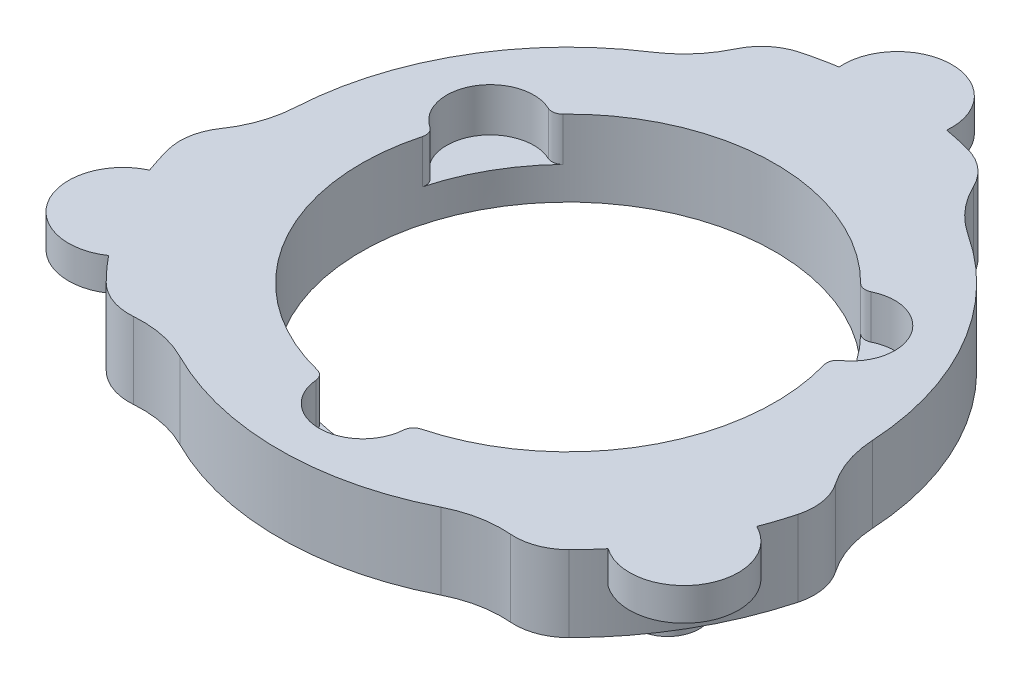
from build123d import *

# Parameters (mm, degrees)
SKETCH1_R                = 19
BOSS_EXTRUDE1_DEPTH      = 3.5
SKETCH2_R                = 30
SKETCH2_R_2              = 19
SKETCH2_R_3              = 2.8
BOSS_EXTRUDE2_DEPTH      = 7
BOSS_EXTRUDE3_DEPTH      = 2
BOSS_EXTRUDE3_DEPTH_BACK = 7
SKETCH4_R                = 2.9
SKETCH5_R                = 5
BOSS_EXTRUDE4_DEPTH      = 3
CUT_EXTRUDE1_START       = -10
SKETCH3_R                = 19
CUT_EXTRUDE1_DEPTH       = 10
CUT_EXTRUDE3_START       = -13
CUT_EXTRUDE3_DEPTH       = 13
FILLET1_R                = 10
FILLET2_R                = 5
CUT_EXTRUDE4_START       = -4
SKETCH8_R                = 4
SKETCH8_R_2              = 19
CUT_EXTRUDE4_DEPTH       = 4
FILLET3_R                = 1


with BuildPart() as part:
    # Sketch1 → Boss-Extrude1 (new body)
    with BuildSketch(Plane(origin=(0, 0, 0), x_dir=(1, 0, 0), z_dir=(0, 1, 0))):
        with Locations(Location((0, 0, 0), (0, 0, 270))):
            Circle(SKETCH1_R)
    extrude(amount=BOSS_EXTRUDE1_DEPTH)

    # Sketch2 → Boss-Extrude2 (add)
    with BuildSketch(Plane(origin=(0, 0, 0), x_dir=(1, 0, 0), z_dir=(0, 1, 0))):
        with Locations(Location((0, 0, 0), (0, 0, 270))):
            Circle(SKETCH2_R)
        with Locations(Location((0, 0, 0), (0, 0, 270))):
            Circle(SKETCH2_R_2, mode=Mode.SUBTRACT)
        with Locations(Location((0, 25, 0), (0, 0, 270))):
            Circle(SKETCH2_R_3, mode=Mode.SUBTRACT)
        with Locations(Location((21.650635095, -12.5, 0), (0, 0, 270))):
            Circle(SKETCH2_R_3, mode=Mode.SUBTRACT)
        with Locations(Location((-21.650635095, -12.5, 0), (0, 0, 270))):
            Circle(SKETCH2_R_3, mode=Mode.SUBTRACT)
    extrude(amount=BOSS_EXTRUDE2_DEPTH)

    # Sketch4 → Boss-Extrude3 (add, two sides: drawn at the far end of the back side and taken through both)
    with BuildSketch(Plane.XZ.offset(-BOSS_EXTRUDE3_DEPTH_BACK)):
        with Locations(Location((-21.650635095, 12.5, 0), (0, 0, 270))):
            Circle(SKETCH4_R)
        with Locations(Location((21.650635095, 12.5, 0), (0, 0, 270))):
            Circle(SKETCH4_R)
        with Locations(Location((0, -25, 0), (0, 0, 270))):
            Circle(SKETCH4_R)
    extrude(amount=BOSS_EXTRUDE3_DEPTH + BOSS_EXTRUDE3_DEPTH_BACK)

    # Sketch5 → Boss-Extrude4 (add)
    with BuildSketch(Plane(origin=(0, 7, 0), x_dir=(1, 0, 0), z_dir=(0, 1, 0))):
        with Locations((-26.103110985, -14.7860609)):
            Circle(SKETCH5_R)
        with Locations((0.246451131, 29.99898768)):
            Circle(SKETCH5_R)
        with Locations((25.856659853, -15.212926781)):
            Circle(SKETCH5_R)
    extrude(amount=-BOSS_EXTRUDE4_DEPTH)

    # Sketch3 → Cut-Extrude1 (cut)
    with BuildSketch(Plane(origin=(0, 3.5, 0), x_dir=(1, 0, 0), z_dir=(0, 1, 0)).offset(CUT_EXTRUDE1_START)):
        with Locations(Location((0, 0, 0), (0, 0, 270))):
            Circle(SKETCH3_R)
    extrude(amount=CUT_EXTRUDE1_DEPTH, mode=Mode.SUBTRACT)

    # Sketch7 → Cut-Extrude3 (cut)
    with BuildSketch(Plane(origin=(0, 7, 0), x_dir=(1, 0, 0), z_dir=(0, 1, 0)).offset(CUT_EXTRUDE3_START)):
        with BuildLine():
            ThreePointArc((-29.54423259, -5.20944533), (-25.980762114, 15), (-10.2606043, 28.190778624))
            Line((-10.2606043, 28.190778624), (-13.773984089, 37.84371026))
            Line((-13.773984089, 37.84371026), (-43.939319858, -7.747687605))
            Line((-43.939319858, -7.747687605), (-29.54423259, -5.20944533))
        make_face()
        with BuildLine():
            ThreePointArc((-26.13264562, -4.6078905), (-22.980662881, 13.267891901), (-9.075772579, 24.935480225))
            Line((-9.075772579, 24.935480225), (-10.2606043, 28.190778624))
            ThreePointArc((-10.2606043, 28.190778624), (-25.980762114, 15), (-29.54423259, -5.20944533))
            Line((-29.54423259, -5.20944533), (-26.13264562, -4.6078905))
        make_face()
        with BuildLine():
            Line((15.259965643, 41.926411025), (10.2606043, 28.190778624))
            ThreePointArc((10.2606043, 28.190778624), (25.980762114, 15), (29.54423259, -5.20944533))
            Line((29.54423259, -5.20944533), (39.660606503, -6.993234998))
            Line((39.660606503, -6.993234998), (15.259965643, 41.926411025))
        make_face()
        with BuildLine():
            Line((10.2606043, 28.190778624), (9.075772579, 24.935480225))
            ThreePointArc((9.075772579, 24.935480225), (21.736841548, 15.220300308), (26.535783801, 0))
            ThreePointArc((26.535783801, 0), (26.434807132, -2.312745947), (26.13264562, -4.6078905))
            Line((26.13264562, -4.6078905), (29.54423259, -5.20944533))
            ThreePointArc((29.54423259, -5.20944533), (25.980762114, 15), (10.2606043, 28.190778624))
        make_face()
        with BuildLine():
            Line((28.679354216, -34.17872342), (19.283628291, -22.981333294))
            ThreePointArc((19.283628291, -22.981333294), (0, -30), (-19.283628291, -22.981333294))
            Line((-19.283628291, -22.981333294), (-25.886622414, -30.850475262))
            Line((-25.886622414, -30.850475262), (28.679354216, -34.17872342))
        make_face()
        with BuildLine():
            Line((19.283628291, -22.981333294), (17.056873041, -20.327589725))
            ThreePointArc((17.056873041, -20.327589725), (0, -26.535783801), (-17.056873041, -20.327589725))
            Line((-17.056873041, -20.327589725), (-19.283628291, -22.981333294))
            ThreePointArc((-19.283628291, -22.981333294), (0, -30), (19.283628291, -22.981333294))
        make_face()
    extrude(amount=CUT_EXTRUDE3_DEPTH, mode=Mode.SUBTRACT)

    # Fillet1
    # the kernel refuses this fillet: 10 mm, written as the material it adds along each edge
    with BuildSketch(Plane(origin=(-26.13264562, 0, 4.6078905), x_dir=(-0.9848077530122318, 0, 0.17364817766679624), z_dir=(0, 1, 0)), Plane(origin=(17.056873041, 0, 20.327589725), x_dir=(0.6427876096865569, 0, 0.7660444431189634), z_dir=(0, 1, 0)), Plane(origin=(9.075772579, 0, -24.935480225), x_dir=(0.34202014332561265, 0, -0.9396926207859289), z_dir=(0, 1, 0))) as fillet1_piece_1:
        with BuildLine():
            CenterArc((9.045274498, -8.297697769), FILLET1_R, 123.92490422, 42.948020906)
            Line((-0.693413056, -6.026582466), (-0.888186807, -5.98116016))
            ThreePointArc((-0.888186807, -5.98116016), (-0.372612378, -3.01031053), (-0.2, 0))
            Line((-0.2, 0), (0, 0.2))
            ThreePointArc((0, 0.2), (1.732108099, 0.2), (3.352595033, 0.165953955))
            Line((3.352595033, 0.165953955), (3.464216199, 0))
        make_face()
    extrude(amount=7)
    with BuildSketch(Plane(origin=(-17.056873041, 0, 20.327589725), x_dir=(0.8344973728156843, 0, 0.551011918894429), z_dir=(0, 1, 0)), Plane(origin=(26.13264562, 0, 4.6078905), x_dir=(0.059941633142754296, 0, -0.99820188369697), z_dir=(0, 1, 0)), Plane(origin=(-9.075772579, 0, -24.935480225), x_dir=(-0.8944390059584274, 0, 0.44718996480254386), z_dir=(0, 1, 0))) as fillet1_piece_2:
        with BuildLine():
            CenterArc((7.20939257, -9.934457095), FILLET1_R, 96.563537437, 42.948020906)
            Line((-0.39597707, -3.441510719), (-0.548084463, -3.311651792))
            ThreePointArc((-0.548084463, -3.311651792), (-0.396677677, -1.697894369), (-0.198689142, 0.022860991))
            Line((-0.198689142, 0.022860991), (0.022860991, 0.198689142))
            ThreePointArc((0.022860991, 0.198689142), (3.03317152, 0.026076764), (6.04348205, 0.198689142))
            Line((6.04348205, 0.198689142), (6.06634304, 0))
        make_face()
    extrude(amount=7)

    # Fillet2
    fillet2_edges = [part.edges().sort_by_distance(p)[0] for p in [
        (-10.2606043, 3.5, -28.190778624),
        (-29.54423259, 3.5, 5.20944533),
        (-19.283628291, 3.5, 22.981333294),
        (19.283628291, 3.5, 22.981333294),
        (29.54423259, 3.5, 5.20944533),
        (10.2606043, 3.5, -28.190778624),
    ]]
    fillet(fillet2_edges, radius=FILLET2_R)

    # Sketch8 → Cut-Extrude4 (cut)
    with BuildSketch(Plane(origin=(0, 7, 0), x_dir=(1, 0, 0), z_dir=(0, 1, 0)).offset(CUT_EXTRUDE4_START)):
        with Locations((-16.524893724, 9.376987118)):
            Circle(SKETCH8_R)
        with Locations(Location((0, 0, 0), (0, 0, 42.512080704))):
            Circle(SKETCH8_R_2)
        with Locations((16.383155917, 9.622484201)):
            Circle(SKETCH8_R)
        with Locations((0.141737807, -18.999471319)):
            Circle(SKETCH8_R)
    extrude(amount=CUT_EXTRUDE4_DEPTH, mode=Mode.SUBTRACT)

    # Fillet3
    # the kernel refuses this fillet: 1 mm, written as the material it takes off along each edge
    with BuildSketch(Plane(origin=(-14.195555863, 8.950278825, -12.628784333), x_dir=(-0.8617980531882996, 0, -0.5072515308216002), z_dir=(0, -1, 0)), Plane(origin=(18.034625983, 8.950278825, -5.979319831), x_dir=(0.8701917383942803, 0, -0.49271324158209956), z_dir=(0, -1, 0))) as fillet3_piece_1:
        with BuildLine():
            CenterArc((0.805364366, 0.995988176), FILLET3_R, 193.528948716, 71.337075115)
            ThreePointArc((-0.166887482, 0.762051552), (-0.079532242, 0.381882385), (0, 0))
            ThreePointArc((0, 0), (0.357939718, 0.016047295), (0.715879437, 0))
        make_face()
    extrude(amount=5.950278825, mode=Mode.SUBTRACT)
    with BuildSketch(Plane(origin=(-18.121826323, 8.950278825, -5.709589366), x_dir=(-0.28086097725665193, 0, 0.9597484625955065), z_dir=(0, -1, 0)), Plane(origin=(14.005562597, 8.950278825, -12.839167276), x_dir=(-0.6907360612225409, 0, -0.7231069725336425), z_dir=(0, -1, 0))) as fillet3_piece_2:
        with BuildLine():
            CenterArc((0.800640781, 0.999789253), FILLET3_R, 197.486602821, 71.337075115)
            ThreePointArc((-0.153146456, 0.699306464), (-0.060897436, 0.353086193), (0, 0))
            ThreePointArc((0, 0), (0.390055765, 0.004004198), (0.78011153, 0))
        make_face()
    extrude(amount=5.950278825, mode=Mode.SUBTRACT)
    with BuildSketch(Plane(origin=(-3.83907012, 8.950278825, 18.608104165), x_dir=(-0.9750194381231715, 0, -0.22211955177780904), z_dir=(0, -1, 0))) as fillet3_piece_3:
        with BuildLine():
            CenterArc((0.800640781, -0.999789253), FILLET3_R, 91.176322064, 71.337075115)
            ThreePointArc((-0.153146456, -0.699306464), (-0.060897436, -0.353086193), (0, 0))
            ThreePointArc((0, 0), (0.390055765, -0.004004198), (0.78011153, 0))
        make_face()
    extrude(amount=5.950278825, mode=Mode.SUBTRACT)
    with BuildSketch(Plane(origin=(4.116263726, 8.950278825, 18.548756641), x_dir=(0.023311579398747933, 0, 0.9997282482084497), z_dir=(0, -1, 0))) as fillet3_piece_4:
        with BuildLine():
            CenterArc((0.805364366, -0.995988176), FILLET3_R, 95.133976169, 71.337075115)
            ThreePointArc((-0.166887482, -0.762051552), (-0.079532242, -0.381882385), (0, 0))
            ThreePointArc((0, 0), (0.357939718, -0.016047295), (0.715879437, 0))
        make_face()
    extrude(amount=5.950278825, mode=Mode.SUBTRACT)


solid = part.part
